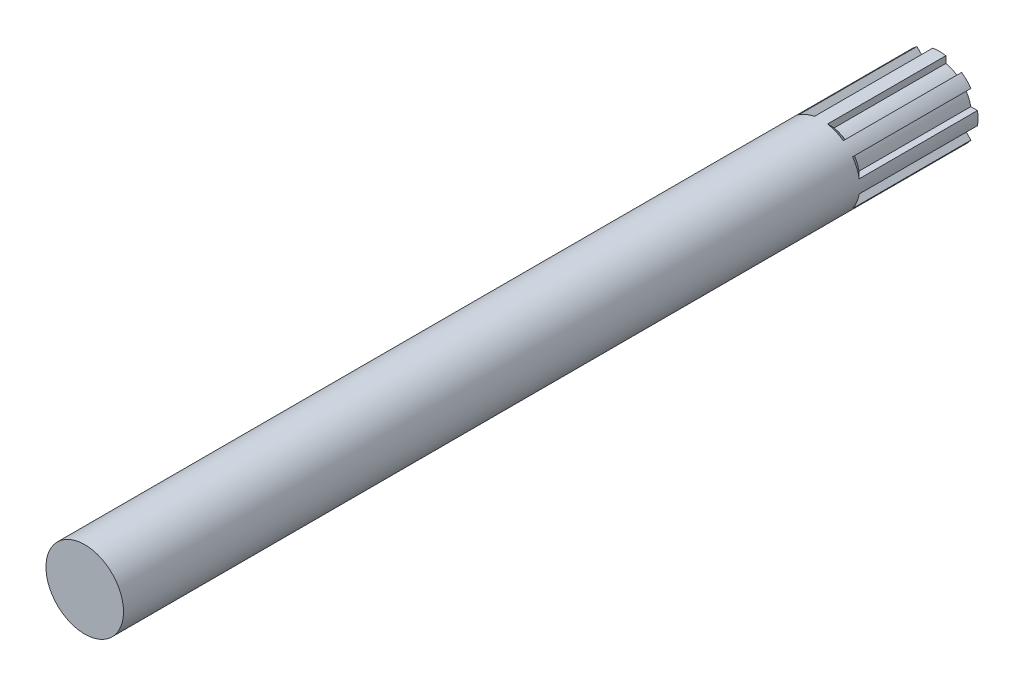
from build123d import *

# Parameters (mm, degrees)
SKETCH1_R           = 2.95
BOSS_EXTRUDE1_DEPTH = 65
CUT_EXTRUDE1_DEPTH  = 8
CHAMFER1_SIZE       = 1


with BuildPart() as part:
    # Sketch1 → Boss-Extrude1 (new body)
    with BuildSketch(Plane.XY):
        Circle(SKETCH1_R)
    extrude(amount=BOSS_EXTRUDE1_DEPTH)

    # Sketch2 → Cut-Extrude1 (cut)
    with BuildSketch(Plane(origin=(0, 0, 0), x_dir=(-1, 0, 0), z_dir=(0, 0, -1))):
        with BuildLine():
            ThreePointArc((-2.398436991, 0.5), (-2.263504855, 0.937574409), (-2.049504451, 1.34239767))
            Line((-2.049504451, 1.34239767), (-2.409337912, 1.702231131))
            ThreePointArc((-2.409337912, 1.702231131), (-2.725444621, 1.128916125), (-2.907318352, 0.5))
            Line((-2.907318352, 0.5), (-2.398436991, 0.5))
        make_face()
        with BuildLine():
            ThreePointArc((-1.34239767, 2.049504451), (-0.937574409, 2.263504855), (-0.5, 2.398436991))
            Line((-0.5, 2.398436991), (-0.5, 2.907318352))
            ThreePointArc((-0.5, 2.907318352), (-1.128916125, 2.725444621), (-1.702231131, 2.409337912))
            Line((-1.702231131, 2.409337912), (-1.34239767, 2.049504451))
        make_face()
        with BuildLine():
            Line((0.5, 2.907318352), (0.5, 2.398436991))
            ThreePointArc((0.5, 2.398436991), (0.937574409, 2.263504855), (1.34239767, 2.049504451))
            Line((1.34239767, 2.049504451), (1.702231131, 2.409337912))
            ThreePointArc((1.702231131, 2.409337912), (1.128916125, 2.725444621), (0.5, 2.907318352))
        make_face()
        with BuildLine():
            Line((2.409337912, 1.702231131), (2.049504451, 1.34239767))
            ThreePointArc((2.049504451, 1.34239767), (2.263504855, 0.937574409), (2.398436991, 0.5))
            Line((2.398436991, 0.5), (2.907318352, 0.5))
            ThreePointArc((2.907318352, 0.5), (2.725444621, 1.128916125), (2.409337912, 1.702231131))
        make_face()
        with BuildLine():
            Line((2.907318352, -0.5), (2.398436991, -0.5))
            ThreePointArc((2.398436991, -0.5), (2.263504855, -0.937574409), (2.049504451, -1.34239767))
            Line((2.049504451, -1.34239767), (2.409337912, -1.702231131))
            ThreePointArc((2.409337912, -1.702231131), (2.725444621, -1.128916125), (2.907318352, -0.5))
        make_face()
        with BuildLine():
            Line((1.702231131, -2.409337912), (1.34239767, -2.049504451))
            ThreePointArc((1.34239767, -2.049504451), (0.937574409, -2.263504855), (0.5, -2.398436991))
            Line((0.5, -2.398436991), (0.5, -2.907318352))
            ThreePointArc((0.5, -2.907318352), (1.128916125, -2.725444621), (1.702231131, -2.409337912))
        make_face()
        with BuildLine():
            ThreePointArc((-0.5, -2.398436991), (-0.937574409, -2.263504855), (-1.34239767, -2.049504451))
            Line((-1.34239767, -2.049504451), (-1.702231131, -2.409337912))
            ThreePointArc((-1.702231131, -2.409337912), (-1.128916125, -2.725444621), (-0.5, -2.907318352))
            Line((-0.5, -2.907318352), (-0.5, -2.398436991))
        make_face()
        with BuildLine():
            ThreePointArc((-2.049504451, -1.34239767), (-2.263504855, -0.937574409), (-2.398436991, -0.5))
            Line((-2.398436991, -0.5), (-2.907318352, -0.5))
            ThreePointArc((-2.907318352, -0.5), (-2.725444621, -1.128916125), (-2.409337912, -1.702231131))
            Line((-2.409337912, -1.702231131), (-2.049504451, -1.34239767))
        make_face()
    extrude(amount=-CUT_EXTRUDE1_DEPTH, mode=Mode.SUBTRACT)

    # Chamfer1
    # the kernel refuses this chamfer: 1 mm, written as the material it takes off along each edge
    with BuildSketch(Plane(origin=(0, 0, 8), x_dir=(0.6453423073627431, -0.7638935176631171, 0), z_dir=(0.7638935176631171, 0.6453423073627431, 0))) as chamfer1_piece_1_section:
        Polygon((2.95, -CHAMFER1_SIZE), (2.95 - CHAMFER1_SIZE, 0), (2.95, 0), align=None)
    chamfer1_piece_1 = revolve(axis=Axis((0, 0, 8), (0, 0, -1)), revolution_arc=125.382690704, mode=Mode.PRIVATE)
    chamfer1_piece_1 = split(chamfer1_piece_1, bisect_by=Plane(origin=(0.5, 0, 8), z_dir=(1, 0, 0)), keep=Keep.TOP, mode=Mode.PRIVATE)
    chamfer1_piece_1 = split(chamfer1_piece_1, bisect_by=Plane(origin=(-0.353553391, -0.353553391, 8), z_dir=(-0.7071067811865415, -0.7071067811865537, 0)), keep=Keep.TOP, mode=Mode.PRIVATE)
    chamfer1_piece_1 = chamfer1_piece_1 - Plane(origin=(0, 0, 8), x_dir=(0.20408163265306725, -0.9789538738948115, 0), z_dir=(0, 0, -1)) * Cylinder(2.45, 12, mode=Mode.PRIVATE)
    add(chamfer1_piece_1, mode=Mode.SUBTRACT)
    with BuildSketch(Plane(origin=(0, 0, 8), x_dir=(0.6453423073627431, -0.7638935176631171, 0), z_dir=(0.7638935176631171, 0.6453423073627431, 0))) as chamfer1_piece_2_section:
        Polygon((2.95, -CHAMFER1_SIZE), (2.95 - CHAMFER1_SIZE, 0), (2.95, 0), align=None)
    chamfer1_piece_2 = revolve(axis=Axis((0, 0, 8), (0, 0, -1)), revolution_arc=125.382690704, mode=Mode.PRIVATE)
    chamfer1_piece_2 = split(chamfer1_piece_2, bisect_by=Plane(origin=(0.353553391, -0.353553391, 8), z_dir=(0.7071067811865517, -0.7071067811865434, 0)), keep=Keep.TOP, mode=Mode.PRIVATE)
    chamfer1_piece_2 = split(chamfer1_piece_2, bisect_by=Plane(origin=(-0.5, 0, 8), z_dir=(-1, 0, 0)), keep=Keep.TOP, mode=Mode.PRIVATE)
    chamfer1_piece_2 = chamfer1_piece_2 - Plane(origin=(0, 0, 8), x_dir=(0.20408163265306725, -0.9789538738948115, 0), z_dir=(0, 0, -1)) * Cylinder(2.45, 12, mode=Mode.PRIVATE)
    add(chamfer1_piece_2, mode=Mode.SUBTRACT)
    with BuildSketch(Plane(origin=(0, 0, 8), x_dir=(0.6453423073627431, -0.7638935176631171, 0), z_dir=(0.7638935176631171, 0.6453423073627431, 0))) as chamfer1_piece_3_section:
        Polygon((2.95, -CHAMFER1_SIZE), (2.95 - CHAMFER1_SIZE, 0), (2.95, 0), align=None)
    chamfer1_piece_3 = revolve(axis=Axis((0, 0, 8), (0, 0, -1)), revolution_arc=125.382690704, mode=Mode.PRIVATE)
    chamfer1_piece_3 = split(chamfer1_piece_3, bisect_by=Plane(origin=(0, -0.5, 8), z_dir=(0, -1, 0)), keep=Keep.TOP, mode=Mode.PRIVATE)
    chamfer1_piece_3 = split(chamfer1_piece_3, bisect_by=Plane(origin=(-0.353553391, 0.353553391, 8), z_dir=(-0.7071067811865515, 0.7071067811865437, 0)), keep=Keep.TOP, mode=Mode.PRIVATE)
    chamfer1_piece_3 = chamfer1_piece_3 - Plane(origin=(0, 0, 8), x_dir=(0.20408163265306725, -0.9789538738948115, 0), z_dir=(0, 0, -1)) * Cylinder(2.45, 12, mode=Mode.PRIVATE)
    add(chamfer1_piece_3, mode=Mode.SUBTRACT)
    with BuildSketch(Plane(origin=(0, 0, 8), x_dir=(-0.083828364721268, -0.9964802081668046, 0), z_dir=(0.9964802081668046, -0.083828364721268, 0))) as chamfer1_piece_4_section:
        Polygon((2.95, -CHAMFER1_SIZE), (2.95 - CHAMFER1_SIZE, 0), (2.95, 0), align=None)
    chamfer1_piece_4 = revolve(axis=Axis((0, 0, 8), (0, 0, -1)), revolution_arc=125.382690704, mode=Mode.PRIVATE)
    chamfer1_piece_4 = split(chamfer1_piece_4, bisect_by=Plane(origin=(0.353553391, -0.353553391, 8), z_dir=(0.7071067811865517, -0.7071067811865434, 0)), keep=Keep.TOP, mode=Mode.PRIVATE)
    chamfer1_piece_4 = split(chamfer1_piece_4, bisect_by=Plane(origin=(-0.5, 0, 8), z_dir=(-1, 0, 0)), keep=Keep.TOP, mode=Mode.PRIVATE)
    chamfer1_piece_4 = chamfer1_piece_4 - Plane(origin=(0, 0, 8), x_dir=(-0.5479174163352548, -0.8365324290644679, 0), z_dir=(0, 0, -1)) * Cylinder(2.45, 12, mode=Mode.PRIVATE)
    add(chamfer1_piece_4, mode=Mode.SUBTRACT)
    with BuildSketch(Plane(origin=(0, 0, 8), x_dir=(-0.083828364721268, -0.9964802081668046, 0), z_dir=(0.9964802081668046, -0.083828364721268, 0))) as chamfer1_piece_5_section:
        Polygon((2.95, -CHAMFER1_SIZE), (2.95 - CHAMFER1_SIZE, 0), (2.95, 0), align=None)
    chamfer1_piece_5 = revolve(axis=Axis((0, 0, 8), (0, 0, -1)), revolution_arc=125.382690704, mode=Mode.PRIVATE)
    chamfer1_piece_5 = split(chamfer1_piece_5, bisect_by=Plane(origin=(0, -0.5, 8), z_dir=(0, -1, 0)), keep=Keep.TOP, mode=Mode.PRIVATE)
    chamfer1_piece_5 = split(chamfer1_piece_5, bisect_by=Plane(origin=(-0.353553391, 0.353553391, 8), z_dir=(-0.7071067811865515, 0.7071067811865437, 0)), keep=Keep.TOP, mode=Mode.PRIVATE)
    chamfer1_piece_5 = chamfer1_piece_5 - Plane(origin=(0, 0, 8), x_dir=(-0.5479174163352548, -0.8365324290644679, 0), z_dir=(0, 0, -1)) * Cylinder(2.45, 12, mode=Mode.PRIVATE)
    add(chamfer1_piece_5, mode=Mode.SUBTRACT)
    with BuildSketch(Plane(origin=(0, 0, 8), x_dir=(-0.083828364721268, -0.9964802081668046, 0), z_dir=(0.9964802081668046, -0.083828364721268, 0))) as chamfer1_piece_6_section:
        Polygon((2.95, -CHAMFER1_SIZE), (2.95 - CHAMFER1_SIZE, 0), (2.95, 0), align=None)
    chamfer1_piece_6 = revolve(axis=Axis((0, 0, 8), (0, 0, -1)), revolution_arc=125.382690704, mode=Mode.PRIVATE)
    chamfer1_piece_6 = split(chamfer1_piece_6, bisect_by=Plane(origin=(-0.353553391, -0.353553391, 8), z_dir=(-0.7071067811865454, -0.7071067811865497, 0)), keep=Keep.TOP, mode=Mode.PRIVATE)
    chamfer1_piece_6 = split(chamfer1_piece_6, bisect_by=Plane(origin=(0, 0.5, 8), z_dir=(0, 1, 0)), keep=Keep.TOP, mode=Mode.PRIVATE)
    chamfer1_piece_6 = chamfer1_piece_6 - Plane(origin=(0, 0, 8), x_dir=(-0.5479174163352548, -0.8365324290644679, 0), z_dir=(0, 0, -1)) * Cylinder(2.45, 12, mode=Mode.PRIVATE)
    add(chamfer1_piece_6, mode=Mode.SUBTRACT)
    with BuildSketch(Plane(origin=(0, 0, 8), x_dir=(-0.7638935176631205, -0.645342307362739, 0), z_dir=(0.645342307362739, -0.7638935176631205, 0))) as chamfer1_piece_7_section:
        Polygon((2.95, -CHAMFER1_SIZE), (2.95 - CHAMFER1_SIZE, 0), (2.95, 0), align=None)
    chamfer1_piece_7 = revolve(axis=Axis((0, 0, 8), (0, 0, -1)), revolution_arc=125.382690704, mode=Mode.PRIVATE)
    chamfer1_piece_7 = split(chamfer1_piece_7, bisect_by=Plane(origin=(0, -0.5, 8), z_dir=(0, -1, 0)), keep=Keep.TOP, mode=Mode.PRIVATE)
    chamfer1_piece_7 = split(chamfer1_piece_7, bisect_by=Plane(origin=(-0.353553391, 0.353553391, 8), z_dir=(-0.7071067811865515, 0.7071067811865437, 0)), keep=Keep.TOP, mode=Mode.PRIVATE)
    chamfer1_piece_7 = chamfer1_piece_7 - Plane(origin=(0, 0, 8), x_dir=(-0.9789538738948118, -0.20408163265306617, 0), z_dir=(0, 0, -1)) * Cylinder(2.45, 12, mode=Mode.PRIVATE)
    add(chamfer1_piece_7, mode=Mode.SUBTRACT)
    with BuildSketch(Plane(origin=(0, 0, 8), x_dir=(-0.7638935176631205, -0.645342307362739, 0), z_dir=(0.645342307362739, -0.7638935176631205, 0))) as chamfer1_piece_8_section:
        Polygon((2.95, -CHAMFER1_SIZE), (2.95 - CHAMFER1_SIZE, 0), (2.95, 0), align=None)
    chamfer1_piece_8 = revolve(axis=Axis((0, 0, 8), (0, 0, -1)), revolution_arc=125.382690704, mode=Mode.PRIVATE)
    chamfer1_piece_8 = split(chamfer1_piece_8, bisect_by=Plane(origin=(-0.353553391, -0.353553391, 8), z_dir=(-0.7071067811865454, -0.7071067811865497, 0)), keep=Keep.TOP, mode=Mode.PRIVATE)
    chamfer1_piece_8 = split(chamfer1_piece_8, bisect_by=Plane(origin=(0, 0.5, 8), z_dir=(0, 1, 0)), keep=Keep.TOP, mode=Mode.PRIVATE)
    chamfer1_piece_8 = chamfer1_piece_8 - Plane(origin=(0, 0, 8), x_dir=(-0.9789538738948118, -0.20408163265306617, 0), z_dir=(0, 0, -1)) * Cylinder(2.45, 12, mode=Mode.PRIVATE)
    add(chamfer1_piece_8, mode=Mode.SUBTRACT)
    with BuildSketch(Plane(origin=(0, 0, 8), x_dir=(-0.7638935176631205, -0.645342307362739, 0), z_dir=(0.645342307362739, -0.7638935176631205, 0))) as chamfer1_piece_9_section:
        Polygon((2.95, -CHAMFER1_SIZE), (2.95 - CHAMFER1_SIZE, 0), (2.95, 0), align=None)
    chamfer1_piece_9 = revolve(axis=Axis((0, 0, 8), (0, 0, -1)), revolution_arc=125.382690704, mode=Mode.PRIVATE)
    chamfer1_piece_9 = split(chamfer1_piece_9, bisect_by=Plane(origin=(-0.5, 0, 8), z_dir=(-1, 0, 0)), keep=Keep.TOP, mode=Mode.PRIVATE)
    chamfer1_piece_9 = split(chamfer1_piece_9, bisect_by=Plane(origin=(0.353553391, 0.353553391, 8), z_dir=(0.7071067811865474, 0.7071067811865477, 0)), keep=Keep.TOP, mode=Mode.PRIVATE)
    chamfer1_piece_9 = chamfer1_piece_9 - Plane(origin=(0, 0, 8), x_dir=(-0.9789538738948118, -0.20408163265306617, 0), z_dir=(0, 0, -1)) * Cylinder(2.45, 12, mode=Mode.PRIVATE)
    add(chamfer1_piece_9, mode=Mode.SUBTRACT)
    with BuildSketch(Plane(origin=(0, 0, 8), x_dir=(-0.9964802081668033, 0.08382836472128195, 0), z_dir=(-0.08382836472128195, -0.9964802081668033, 0))) as chamfer1_piece_10_section:
        Polygon((2.95, -CHAMFER1_SIZE), (2.95 - CHAMFER1_SIZE, 0), (2.95, 0), align=None)
    chamfer1_piece_10 = revolve(axis=Axis((0, 0, 8), (0, 0, -1)), revolution_arc=125.382690704, mode=Mode.PRIVATE)
    chamfer1_piece_10 = split(chamfer1_piece_10, bisect_by=Plane(origin=(-0.353553391, -0.353553391, 8), z_dir=(-0.7071067811865454, -0.7071067811865497, 0)), keep=Keep.TOP, mode=Mode.PRIVATE)
    chamfer1_piece_10 = split(chamfer1_piece_10, bisect_by=Plane(origin=(0, 0.5, 8), z_dir=(0, 1, 0)), keep=Keep.TOP, mode=Mode.PRIVATE)
    chamfer1_piece_10 = chamfer1_piece_10 - Plane(origin=(0, 0, 8), x_dir=(-0.836532429064466, 0.5479174163352577, 0), z_dir=(0, 0, -1)) * Cylinder(2.45, 12, mode=Mode.PRIVATE)
    add(chamfer1_piece_10, mode=Mode.SUBTRACT)
    with BuildSketch(Plane(origin=(0, 0, 8), x_dir=(-0.9964802081668033, 0.08382836472128195, 0), z_dir=(-0.08382836472128195, -0.9964802081668033, 0))) as chamfer1_piece_11_section:
        Polygon((2.95, -CHAMFER1_SIZE), (2.95 - CHAMFER1_SIZE, 0), (2.95, 0), align=None)
    chamfer1_piece_11 = revolve(axis=Axis((0, 0, 8), (0, 0, -1)), revolution_arc=125.382690704, mode=Mode.PRIVATE)
    chamfer1_piece_11 = split(chamfer1_piece_11, bisect_by=Plane(origin=(-0.5, 0, 8), z_dir=(-1, 0, 0)), keep=Keep.TOP, mode=Mode.PRIVATE)
    chamfer1_piece_11 = split(chamfer1_piece_11, bisect_by=Plane(origin=(0.353553391, 0.353553391, 8), z_dir=(0.7071067811865474, 0.7071067811865477, 0)), keep=Keep.TOP, mode=Mode.PRIVATE)
    chamfer1_piece_11 = chamfer1_piece_11 - Plane(origin=(0, 0, 8), x_dir=(-0.836532429064466, 0.5479174163352577, 0), z_dir=(0, 0, -1)) * Cylinder(2.45, 12, mode=Mode.PRIVATE)
    add(chamfer1_piece_11, mode=Mode.SUBTRACT)
    with BuildSketch(Plane(origin=(0, 0, 8), x_dir=(-0.9964802081668033, 0.08382836472128195, 0), z_dir=(-0.08382836472128195, -0.9964802081668033, 0))) as chamfer1_piece_12_section:
        Polygon((2.95, -CHAMFER1_SIZE), (2.95 - CHAMFER1_SIZE, 0), (2.95, 0), align=None)
    chamfer1_piece_12 = revolve(axis=Axis((0, 0, 8), (0, 0, -1)), revolution_arc=125.382690704, mode=Mode.PRIVATE)
    chamfer1_piece_12 = split(chamfer1_piece_12, bisect_by=Plane(origin=(-0.353553391, 0.353553391, 8), z_dir=(-0.7071067811865565, 0.7071067811865386, 0)), keep=Keep.TOP, mode=Mode.PRIVATE)
    chamfer1_piece_12 = split(chamfer1_piece_12, bisect_by=Plane(origin=(0.5, 0, 8), z_dir=(1, 0, 0)), keep=Keep.TOP, mode=Mode.PRIVATE)
    chamfer1_piece_12 = chamfer1_piece_12 - Plane(origin=(0, 0, 8), x_dir=(-0.836532429064466, 0.5479174163352577, 0), z_dir=(0, 0, -1)) * Cylinder(2.45, 12, mode=Mode.PRIVATE)
    add(chamfer1_piece_12, mode=Mode.SUBTRACT)
    with BuildSketch(Plane(origin=(0, 0, 8), x_dir=(0.9964802081668043, -0.08382836472127134, 0), z_dir=(0.08382836472127134, 0.9964802081668043, 0))) as chamfer1_piece_13_section:
        Polygon((2.95, -CHAMFER1_SIZE), (2.95 - CHAMFER1_SIZE, 0), (2.95, 0), align=None)
    chamfer1_piece_13 = revolve(axis=Axis((0, 0, 8), (0, 0, -1)), revolution_arc=125.382690704, mode=Mode.PRIVATE)
    chamfer1_piece_13 = split(chamfer1_piece_13, bisect_by=Plane(origin=(0.353553391, 0.353553391, 8), z_dir=(0.707106781186541, 0.7071067811865541, 0)), keep=Keep.TOP, mode=Mode.PRIVATE)
    chamfer1_piece_13 = split(chamfer1_piece_13, bisect_by=Plane(origin=(0, -0.5, 8), z_dir=(0, -1, 0)), keep=Keep.TOP, mode=Mode.PRIVATE)
    chamfer1_piece_13 = chamfer1_piece_13 - Plane(origin=(0, 0, 8), x_dir=(0.8365324290644678, -0.5479174163352549, 0), z_dir=(0, 0, -1)) * Cylinder(2.45, 12, mode=Mode.PRIVATE)
    add(chamfer1_piece_13, mode=Mode.SUBTRACT)
    with BuildSketch(Plane(origin=(0, 0, 8), x_dir=(0.9964802081668043, -0.08382836472127134, 0), z_dir=(0.08382836472127134, 0.9964802081668043, 0))) as chamfer1_piece_14_section:
        Polygon((2.95, -CHAMFER1_SIZE), (2.95 - CHAMFER1_SIZE, 0), (2.95, 0), align=None)
    chamfer1_piece_14 = revolve(axis=Axis((0, 0, 8), (0, 0, -1)), revolution_arc=125.382690704, mode=Mode.PRIVATE)
    chamfer1_piece_14 = split(chamfer1_piece_14, bisect_by=Plane(origin=(0.5, 0, 8), z_dir=(1, 0, 0)), keep=Keep.TOP, mode=Mode.PRIVATE)
    chamfer1_piece_14 = split(chamfer1_piece_14, bisect_by=Plane(origin=(-0.353553391, -0.353553391, 8), z_dir=(-0.7071067811865415, -0.7071067811865537, 0)), keep=Keep.TOP, mode=Mode.PRIVATE)
    chamfer1_piece_14 = chamfer1_piece_14 - Plane(origin=(0, 0, 8), x_dir=(0.8365324290644678, -0.5479174163352549, 0), z_dir=(0, 0, -1)) * Cylinder(2.45, 12, mode=Mode.PRIVATE)
    add(chamfer1_piece_14, mode=Mode.SUBTRACT)
    with BuildSketch(Plane(origin=(0, 0, 8), x_dir=(0.9964802081668043, -0.08382836472127134, 0), z_dir=(0.08382836472127134, 0.9964802081668043, 0))) as chamfer1_piece_15_section:
        Polygon((2.95, -CHAMFER1_SIZE), (2.95 - CHAMFER1_SIZE, 0), (2.95, 0), align=None)
    chamfer1_piece_15 = revolve(axis=Axis((0, 0, 8), (0, 0, -1)), revolution_arc=125.382690704, mode=Mode.PRIVATE)
    chamfer1_piece_15 = split(chamfer1_piece_15, bisect_by=Plane(origin=(0.353553391, -0.353553391, 8), z_dir=(0.7071067811865517, -0.7071067811865434, 0)), keep=Keep.TOP, mode=Mode.PRIVATE)
    chamfer1_piece_15 = split(chamfer1_piece_15, bisect_by=Plane(origin=(-0.5, 0, 8), z_dir=(-1, 0, 0)), keep=Keep.TOP, mode=Mode.PRIVATE)
    chamfer1_piece_15 = chamfer1_piece_15 - Plane(origin=(0, 0, 8), x_dir=(0.8365324290644678, -0.5479174163352549, 0), z_dir=(0, 0, -1)) * Cylinder(2.45, 12, mode=Mode.PRIVATE)
    add(chamfer1_piece_15, mode=Mode.SUBTRACT)
    with BuildSketch(Plane(origin=(0, 0, 8), x_dir=(0.7638935176631216, 0.6453423073627377, 0), z_dir=(-0.6453423073627377, 0.7638935176631216, 0))) as chamfer1_piece_16_section:
        Polygon((2.95, -CHAMFER1_SIZE), (2.95 - CHAMFER1_SIZE, 0), (2.95, 0), align=None)
    chamfer1_piece_16 = revolve(axis=Axis((0, 0, 8), (0, 0, -1)), revolution_arc=125.382690704, mode=Mode.PRIVATE)
    chamfer1_piece_16 = split(chamfer1_piece_16, bisect_by=Plane(origin=(0, 0.5, 8), z_dir=(0, 1, 0)), keep=Keep.TOP, mode=Mode.PRIVATE)
    chamfer1_piece_16 = split(chamfer1_piece_16, bisect_by=Plane(origin=(0.353553391, -0.353553391, 8), z_dir=(0.707106781186556, -0.707106781186539, 0)), keep=Keep.TOP, mode=Mode.PRIVATE)
    chamfer1_piece_16 = chamfer1_piece_16 - Plane(origin=(0, 0, 8), x_dir=(0.8365324290644678, -0.5479174163352549, 0), z_dir=(0, 0, -1)) * Cylinder(2.45, 12, mode=Mode.PRIVATE)
    add(chamfer1_piece_16, mode=Mode.SUBTRACT)
    with BuildSketch(Plane(origin=(0, 0, 8), x_dir=(0.7638935176631216, 0.6453423073627377, 0), z_dir=(-0.6453423073627377, 0.7638935176631216, 0))) as chamfer1_piece_17_section:
        Polygon((2.95, -CHAMFER1_SIZE), (2.95 - CHAMFER1_SIZE, 0), (2.95, 0), align=None)
    chamfer1_piece_17 = revolve(axis=Axis((0, 0, 8), (0, 0, -1)), revolution_arc=125.382690704, mode=Mode.PRIVATE)
    chamfer1_piece_17 = split(chamfer1_piece_17, bisect_by=Plane(origin=(0.353553391, 0.353553391, 8), z_dir=(0.707106781186541, 0.7071067811865541, 0)), keep=Keep.TOP, mode=Mode.PRIVATE)
    chamfer1_piece_17 = split(chamfer1_piece_17, bisect_by=Plane(origin=(0, -0.5, 8), z_dir=(0, -1, 0)), keep=Keep.TOP, mode=Mode.PRIVATE)
    chamfer1_piece_17 = chamfer1_piece_17 - Plane(origin=(0, 0, 8), x_dir=(0.8365324290644678, -0.5479174163352549, 0), z_dir=(0, 0, -1)) * Cylinder(2.45, 12, mode=Mode.PRIVATE)
    add(chamfer1_piece_17, mode=Mode.SUBTRACT)
    with BuildSketch(Plane(origin=(0, 0, 8), x_dir=(0.7638935176631216, 0.6453423073627377, 0), z_dir=(-0.6453423073627377, 0.7638935176631216, 0))) as chamfer1_piece_18_section:
        Polygon((2.95, -CHAMFER1_SIZE), (2.95 - CHAMFER1_SIZE, 0), (2.95, 0), align=None)
    chamfer1_piece_18 = revolve(axis=Axis((0, 0, 8), (0, 0, -1)), revolution_arc=125.382690704, mode=Mode.PRIVATE)
    chamfer1_piece_18 = split(chamfer1_piece_18, bisect_by=Plane(origin=(0.5, 0, 8), z_dir=(1, 0, 0)), keep=Keep.TOP, mode=Mode.PRIVATE)
    chamfer1_piece_18 = split(chamfer1_piece_18, bisect_by=Plane(origin=(-0.353553391, -0.353553391, 8), z_dir=(-0.7071067811865415, -0.7071067811865537, 0)), keep=Keep.TOP, mode=Mode.PRIVATE)
    chamfer1_piece_18 = chamfer1_piece_18 - Plane(origin=(0, 0, 8), x_dir=(0.8365324290644678, -0.5479174163352549, 0), z_dir=(0, 0, -1)) * Cylinder(2.45, 12, mode=Mode.PRIVATE)
    add(chamfer1_piece_18, mode=Mode.SUBTRACT)
    with BuildSketch(Plane(origin=(0, 0, 8), x_dir=(0.08382836472126272, 0.996480208166805, 0), z_dir=(-0.996480208166805, 0.08382836472126272, 0))) as chamfer1_piece_19_section:
        Polygon((2.95, -CHAMFER1_SIZE), (2.95 - CHAMFER1_SIZE, 0), (2.95, 0), align=None)
    chamfer1_piece_19 = revolve(axis=Axis((0, 0, 8), (0, 0, -1)), revolution_arc=125.382690704, mode=Mode.PRIVATE)
    chamfer1_piece_19 = split(chamfer1_piece_19, bisect_by=Plane(origin=(-0.353553391, 0.353553391, 8), z_dir=(-0.7071067811865565, 0.7071067811865386, 0)), keep=Keep.TOP, mode=Mode.PRIVATE)
    chamfer1_piece_19 = split(chamfer1_piece_19, bisect_by=Plane(origin=(0.5, 0, 8), z_dir=(1, 0, 0)), keep=Keep.TOP, mode=Mode.PRIVATE)
    chamfer1_piece_19 = chamfer1_piece_19 - Plane(origin=(0, 0, 8), x_dir=(0.8365324290644678, -0.5479174163352549, 0), z_dir=(0, 0, -1)) * Cylinder(2.45, 12, mode=Mode.PRIVATE)
    add(chamfer1_piece_19, mode=Mode.SUBTRACT)
    with BuildSketch(Plane(origin=(0, 0, 8), x_dir=(0.08382836472126272, 0.996480208166805, 0), z_dir=(-0.996480208166805, 0.08382836472126272, 0))) as chamfer1_piece_20_section:
        Polygon((2.95, -CHAMFER1_SIZE), (2.95 - CHAMFER1_SIZE, 0), (2.95, 0), align=None)
    chamfer1_piece_20 = revolve(axis=Axis((0, 0, 8), (0, 0, -1)), revolution_arc=125.382690704, mode=Mode.PRIVATE)
    chamfer1_piece_20 = split(chamfer1_piece_20, bisect_by=Plane(origin=(0, 0.5, 8), z_dir=(0, 1, 0)), keep=Keep.TOP, mode=Mode.PRIVATE)
    chamfer1_piece_20 = split(chamfer1_piece_20, bisect_by=Plane(origin=(0.353553391, -0.353553391, 8), z_dir=(0.707106781186556, -0.707106781186539, 0)), keep=Keep.TOP, mode=Mode.PRIVATE)
    chamfer1_piece_20 = chamfer1_piece_20 - Plane(origin=(0, 0, 8), x_dir=(0.8365324290644678, -0.5479174163352549, 0), z_dir=(0, 0, -1)) * Cylinder(2.45, 12, mode=Mode.PRIVATE)
    add(chamfer1_piece_20, mode=Mode.SUBTRACT)
    with BuildSketch(Plane(origin=(0, 0, 8), x_dir=(0.08382836472126272, 0.996480208166805, 0), z_dir=(-0.996480208166805, 0.08382836472126272, 0))) as chamfer1_piece_21_section:
        Polygon((2.95, -CHAMFER1_SIZE), (2.95 - CHAMFER1_SIZE, 0), (2.95, 0), align=None)
    chamfer1_piece_21 = revolve(axis=Axis((0, 0, 8), (0, 0, -1)), revolution_arc=125.382690704, mode=Mode.PRIVATE)
    chamfer1_piece_21 = split(chamfer1_piece_21, bisect_by=Plane(origin=(0.353553391, 0.353553391, 8), z_dir=(0.707106781186541, 0.7071067811865541, 0)), keep=Keep.TOP, mode=Mode.PRIVATE)
    chamfer1_piece_21 = split(chamfer1_piece_21, bisect_by=Plane(origin=(0, -0.5, 8), z_dir=(0, -1, 0)), keep=Keep.TOP, mode=Mode.PRIVATE)
    chamfer1_piece_21 = chamfer1_piece_21 - Plane(origin=(0, 0, 8), x_dir=(0.8365324290644678, -0.5479174163352549, 0), z_dir=(0, 0, -1)) * Cylinder(2.45, 12, mode=Mode.PRIVATE)
    add(chamfer1_piece_21, mode=Mode.SUBTRACT)
    with BuildSketch(Plane(origin=(0, 0, 8), x_dir=(-0.6453423073627307, 0.7638935176631274, 0), z_dir=(-0.7638935176631274, -0.6453423073627307, 0))) as chamfer1_piece_22_section:
        Polygon((2.95, -CHAMFER1_SIZE), (2.95 - CHAMFER1_SIZE, 0), (2.95, 0), align=None)
    chamfer1_piece_22 = revolve(axis=Axis((0, 0, 8), (0, 0, -1)), revolution_arc=125.382690704, mode=Mode.PRIVATE)
    chamfer1_piece_22 = split(chamfer1_piece_22, bisect_by=Plane(origin=(-0.5, 0, 8), z_dir=(-1, 0, 0)), keep=Keep.TOP, mode=Mode.PRIVATE)
    chamfer1_piece_22 = split(chamfer1_piece_22, bisect_by=Plane(origin=(0.353553391, 0.353553391, 8), z_dir=(0.7071067811865474, 0.7071067811865477, 0)), keep=Keep.TOP, mode=Mode.PRIVATE)
    chamfer1_piece_22 = chamfer1_piece_22 - Plane(origin=(0, 0, 8), x_dir=(-0.2040816326530623, 0.9789538738948126, 0), z_dir=(0, 0, -1)) * Cylinder(2.45, 12, mode=Mode.PRIVATE)
    add(chamfer1_piece_22, mode=Mode.SUBTRACT)
    with BuildSketch(Plane(origin=(0, 0, 8), x_dir=(-0.6453423073627307, 0.7638935176631274, 0), z_dir=(-0.7638935176631274, -0.6453423073627307, 0))) as chamfer1_piece_23_section:
        Polygon((2.95, -CHAMFER1_SIZE), (2.95 - CHAMFER1_SIZE, 0), (2.95, 0), align=None)
    chamfer1_piece_23 = revolve(axis=Axis((0, 0, 8), (0, 0, -1)), revolution_arc=125.382690704, mode=Mode.PRIVATE)
    chamfer1_piece_23 = split(chamfer1_piece_23, bisect_by=Plane(origin=(-0.353553391, 0.353553391, 8), z_dir=(-0.7071067811865565, 0.7071067811865386, 0)), keep=Keep.TOP, mode=Mode.PRIVATE)
    chamfer1_piece_23 = split(chamfer1_piece_23, bisect_by=Plane(origin=(0.5, 0, 8), z_dir=(1, 0, 0)), keep=Keep.TOP, mode=Mode.PRIVATE)
    chamfer1_piece_23 = chamfer1_piece_23 - Plane(origin=(0, 0, 8), x_dir=(-0.2040816326530623, 0.9789538738948126, 0), z_dir=(0, 0, -1)) * Cylinder(2.45, 12, mode=Mode.PRIVATE)
    add(chamfer1_piece_23, mode=Mode.SUBTRACT)
    with BuildSketch(Plane(origin=(0, 0, 8), x_dir=(-0.6453423073627307, 0.7638935176631274, 0), z_dir=(-0.7638935176631274, -0.6453423073627307, 0))) as chamfer1_piece_24_section:
        Polygon((2.95, -CHAMFER1_SIZE), (2.95 - CHAMFER1_SIZE, 0), (2.95, 0), align=None)
    chamfer1_piece_24 = revolve(axis=Axis((0, 0, 8), (0, 0, -1)), revolution_arc=125.382690704, mode=Mode.PRIVATE)
    chamfer1_piece_24 = split(chamfer1_piece_24, bisect_by=Plane(origin=(0, 0.5, 8), z_dir=(0, 1, 0)), keep=Keep.TOP, mode=Mode.PRIVATE)
    chamfer1_piece_24 = split(chamfer1_piece_24, bisect_by=Plane(origin=(0.353553391, -0.353553391, 8), z_dir=(0.707106781186556, -0.707106781186539, 0)), keep=Keep.TOP, mode=Mode.PRIVATE)
    chamfer1_piece_24 = chamfer1_piece_24 - Plane(origin=(0, 0, 8), x_dir=(-0.2040816326530623, 0.9789538738948126, 0), z_dir=(0, 0, -1)) * Cylinder(2.45, 12, mode=Mode.PRIVATE)
    add(chamfer1_piece_24, mode=Mode.SUBTRACT)


solid = part.part
